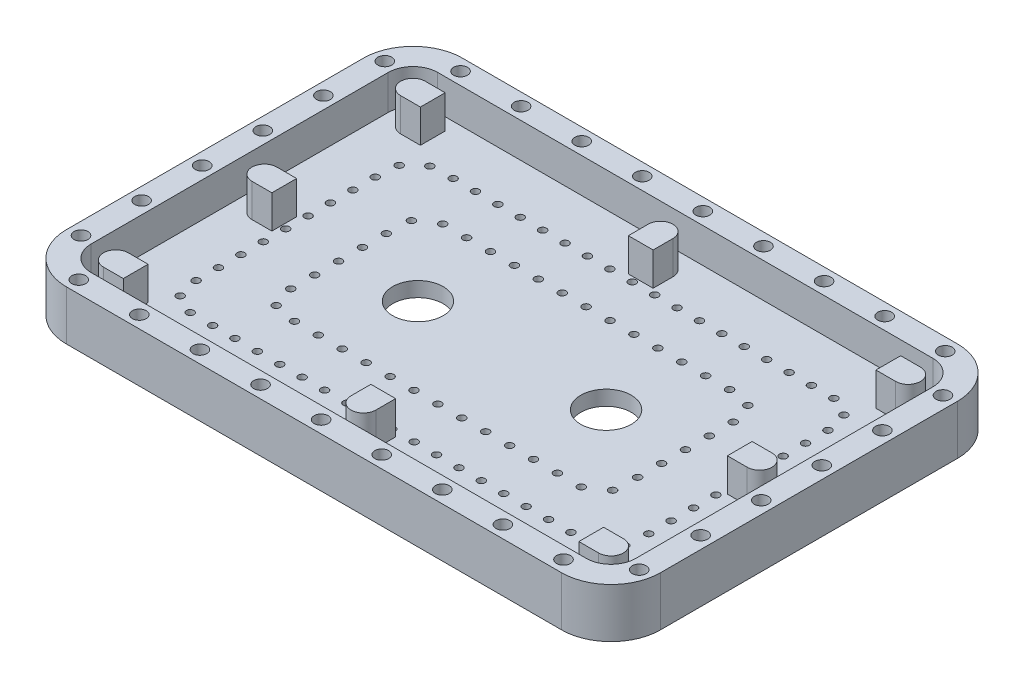
from build123d import *

# Parameters (mm, degrees)
SKETCH1_W                       = 120
SKETCH1_H                       = 80
BOSS_EXTRUDE1_DEPTH             = 10
SKETCH2_W                       = 110
SKETCH2_H                       = 70
CUT_EXTRUDE1_DEPTH              = 7
F_10_2_10_2_DIAMETER_HOLE1_D    = 10.2
FILLET1_R                       = 10
FILLET3_R                       = 5
F_2_5MM_CLEARANCE_DOWEL_HOLE1_D = 2.8
CRVPATTERN1_START               = -3
CRVPATTERN1_OUTLINE_R           = 1.4
CRVPATTERN1_DEPTH               = 10
F_1_5MM_DOWEL_HOLE2_D           = 1.5
CRVPATTERN3_START               = -3
CRVPATTERN3_OUTLINE_R           = 0.75
CRVPATTERN3_DEPTH               = 3
F_1_5MM_DOWEL_HOLE3_D           = 1.5
CRVPATTERN4_START               = -3
CRVPATTERN4_OUTLINE_R           = 0.75
CRVPATTERN4_DEPTH               = 3
BOSS_EXTRUDE2_DEPTH             = 6.7
SKETCH24_R                      = 2
CUT_EXTRUDE2_DEPTH              = 1.5
CRVPATTERN5_START               = -3
CRVPATTERN5_OUTLINE_R           = 2
CRVPATTERN5_OUTLINE_R_2         = 1.4
CRVPATTERN5_DEPTH               = 1.5


# Read off the part's stored shape, not the designer's step: CrvPattern1, CrvPattern3, CrvPattern4, CrvPattern5
with BuildPart() as part:
    # Sketch1 → Boss-Extrude1 (new body)
    with BuildSketch(Plane(origin=(0, 7, 0), x_dir=(1, 0, 0), z_dir=(0, 1, 0))):
        Rectangle(SKETCH1_W, SKETCH1_H)
    extrude(amount=-BOSS_EXTRUDE1_DEPTH)

    # Sketch2 → Cut-Extrude1 (cut)
    with BuildSketch(Plane(origin=(0, 7, 0), x_dir=(-1, 0, 0), z_dir=(0, 1, 0))):
        Rectangle(SKETCH2_W, SKETCH2_H)
    extrude(amount=-CUT_EXTRUDE1_DEPTH, mode=Mode.SUBTRACT)

    # Ø10.2 (10.2) Diameter Hole1 (through all)
    with Locations(Plane(origin=(0, 0, 0), x_dir=(1, 0, 0), z_dir=(0, 1, 0))):
        with Locations((19, 0), (-19, 0)):
            Hole(F_10_2_10_2_DIAMETER_HOLE1_D / 2)

    # Fillet1
    fillet1_edges = [part.edges().sort_by_distance(p)[0] for p in [
        (-60, 2, -40),
        (60, 2, -40),
        (60, 2, 40),
        (-60, 2, 40),
    ]]
    fillet(fillet1_edges, radius=FILLET1_R)

    # Fillet3
    fillet3_edges = [part.edges().sort_by_distance(p)[0] for p in [
        (-55, 3.5, 35),
        (-55, 3.5, -35),
        (55, 3.5, -35),
        (55, 3.5, 35),
    ]]
    fillet(fillet3_edges, radius=FILLET3_R)

    # Ø2.5mm Clearance Dowel Hole1 (through all)
    with Locations(Plane(origin=(0, 7, 0), x_dir=(1, 0, 0), z_dir=(0, 1, 0))):
        with Locations((50, 37.5)):
            Hole(F_2_5MM_CLEARANCE_DOWEL_HOLE1_D / 2)

    # CrvPattern1 outline → CrvPattern1 (cut)
    with BuildSketch(Plane(origin=(0, 0, 0), x_dir=(1, 0, 0), z_dir=(0, 1, 0)).offset(CRVPATTERN1_START)):
        with Locations((37.762537007, 37.5)):
            Circle(CRVPATTERN1_OUTLINE_R)
        with Locations((25.525074013, 37.5)):
            Circle(CRVPATTERN1_OUTLINE_R)
        with Locations((13.28761102, 37.5)):
            Circle(CRVPATTERN1_OUTLINE_R)
        with Locations((1.050148026, 37.5)):
            Circle(CRVPATTERN1_OUTLINE_R)
        with Locations((-11.187314967, 37.5)):
            Circle(CRVPATTERN1_OUTLINE_R)
        with Locations((-23.424777961, 37.5)):
            Circle(CRVPATTERN1_OUTLINE_R)
        with Locations((-35.662240954, 37.5)):
            Circle(CRVPATTERN1_OUTLINE_R)
        with Locations((-47.899703948, 37.5)):
            Circle(CRVPATTERN1_OUTLINE_R)
        with Locations((-57.320580195, 31.630676428)):
            Circle(CRVPATTERN1_OUTLINE_R)
        with Locations((-57.5, 19.406342516)):
            Circle(CRVPATTERN1_OUTLINE_R)
        with Locations((-57.5, 7.168879523)):
            Circle(CRVPATTERN1_OUTLINE_R)
        with Locations((-57.5, -5.068583471)):
            Circle(CRVPATTERN1_OUTLINE_R)
        with Locations((-57.5, -17.306046464)):
            Circle(CRVPATTERN1_OUTLINE_R)
        with Locations((-57.5, -29.543509458)):
            Circle(CRVPATTERN1_OUTLINE_R)
        with Locations((-50, -37.5)):
            Circle(CRVPATTERN1_OUTLINE_R)
        with Locations((-37.762537007, -37.5)):
            Circle(CRVPATTERN1_OUTLINE_R)
        with Locations((-25.525074013, -37.5)):
            Circle(CRVPATTERN1_OUTLINE_R)
        with Locations((-13.28761102, -37.5)):
            Circle(CRVPATTERN1_OUTLINE_R)
        with Locations((-1.050148026, -37.5)):
            Circle(CRVPATTERN1_OUTLINE_R)
        with Locations((11.187314967, -37.5)):
            Circle(CRVPATTERN1_OUTLINE_R)
        with Locations((23.424777961, -37.5)):
            Circle(CRVPATTERN1_OUTLINE_R)
        with Locations((35.662240954, -37.5)):
            Circle(CRVPATTERN1_OUTLINE_R)
        with Locations((47.899703948, -37.5)):
            Circle(CRVPATTERN1_OUTLINE_R)
        with Locations((57.320580195, -31.630676428)):
            Circle(CRVPATTERN1_OUTLINE_R)
        with Locations((57.5, -19.406342516)):
            Circle(CRVPATTERN1_OUTLINE_R)
        with Locations((57.5, -7.168879523)):
            Circle(CRVPATTERN1_OUTLINE_R)
        with Locations((57.5, 5.068583471)):
            Circle(CRVPATTERN1_OUTLINE_R)
        with Locations((57.5, 17.306046464)):
            Circle(CRVPATTERN1_OUTLINE_R)
        with Locations((57.5, 29.543509458)):
            Circle(CRVPATTERN1_OUTLINE_R)
    extrude(amount=CRVPATTERN1_DEPTH, mode=Mode.SUBTRACT)

    # Ø1.5mm Dowel Hole2 (through all)
    with Locations(Plane(origin=(0, 0, 0), x_dir=(1, 0, 0), z_dir=(0, 1, 0))):
        with Locations((40, 25)):
            Hole(F_1_5MM_DOWEL_HOLE2_D / 2)

    # CrvPattern3 outline → CrvPattern3 (cut)
    with BuildSketch(Plane(origin=(0, 0, 0), x_dir=(1, 0, 0), z_dir=(0, 1, 0)).offset(CRVPATTERN3_START)):
        with Locations((35.476401224, 25)):
            Circle(CRVPATTERN3_OUTLINE_R)
        with Locations((30.952802449, 25)):
            Circle(CRVPATTERN3_OUTLINE_R)
        with Locations((26.429203673, 25)):
            Circle(CRVPATTERN3_OUTLINE_R)
        with Locations((21.905604898, 25)):
            Circle(CRVPATTERN3_OUTLINE_R)
        with Locations((17.382006122, 25)):
            Circle(CRVPATTERN3_OUTLINE_R)
        with Locations((12.858407346, 25)):
            Circle(CRVPATTERN3_OUTLINE_R)
        with Locations((8.334808571, 25)):
            Circle(CRVPATTERN3_OUTLINE_R)
        with Locations((3.811209795, 25)):
            Circle(CRVPATTERN3_OUTLINE_R)
        with Locations((-0.71238898, 25)):
            Circle(CRVPATTERN3_OUTLINE_R)
        with Locations((-5.235987756, 25)):
            Circle(CRVPATTERN3_OUTLINE_R)
        with Locations((-9.759586532, 25)):
            Circle(CRVPATTERN3_OUTLINE_R)
        with Locations((-14.283185307, 25)):
            Circle(CRVPATTERN3_OUTLINE_R)
        with Locations((-18.806784083, 25)):
            Circle(CRVPATTERN3_OUTLINE_R)
        with Locations((-23.330382858, 25)):
            Circle(CRVPATTERN3_OUTLINE_R)
        with Locations((-27.853981634, 25)):
            Circle(CRVPATTERN3_OUTLINE_R)
        with Locations((-32.37758041, 25)):
            Circle(CRVPATTERN3_OUTLINE_R)
        with Locations((-36.901179185, 25)):
            Circle(CRVPATTERN3_OUTLINE_R)
        with Locations((-41.405574173, 24.798370687)):
            Circle(CRVPATTERN3_OUTLINE_R)
        with Locations((-44.64124129, 21.859806251)):
            Circle(CRVPATTERN3_OUTLINE_R)
        with Locations((-45, 17.382006122)):
            Circle(CRVPATTERN3_OUTLINE_R)
        with Locations((-45, 12.858407346)):
            Circle(CRVPATTERN3_OUTLINE_R)
        with Locations((-45, 8.334808571)):
            Circle(CRVPATTERN3_OUTLINE_R)
        with Locations((-45, 3.811209795)):
            Circle(CRVPATTERN3_OUTLINE_R)
        with Locations((-45, -0.71238898)):
            Circle(CRVPATTERN3_OUTLINE_R)
        with Locations((-45, -5.235987756)):
            Circle(CRVPATTERN3_OUTLINE_R)
        with Locations((-45, -9.759586532)):
            Circle(CRVPATTERN3_OUTLINE_R)
        with Locations((-45, -14.283185307)):
            Circle(CRVPATTERN3_OUTLINE_R)
        with Locations((-45, -18.806784083)):
            Circle(CRVPATTERN3_OUTLINE_R)
        with Locations((-43.931260104, -23.089529736)):
            Circle(CRVPATTERN3_OUTLINE_R)
        with Locations((-40, -25)):
            Circle(CRVPATTERN3_OUTLINE_R)
        with Locations((-35.476401224, -25)):
            Circle(CRVPATTERN3_OUTLINE_R)
        with Locations((-30.952802449, -25)):
            Circle(CRVPATTERN3_OUTLINE_R)
        with Locations((-26.429203673, -25)):
            Circle(CRVPATTERN3_OUTLINE_R)
        with Locations((-21.905604898, -25)):
            Circle(CRVPATTERN3_OUTLINE_R)
        with Locations((-17.382006122, -25)):
            Circle(CRVPATTERN3_OUTLINE_R)
        with Locations((-12.858407346, -25)):
            Circle(CRVPATTERN3_OUTLINE_R)
        with Locations((-8.334808571, -25)):
            Circle(CRVPATTERN3_OUTLINE_R)
        with Locations((-3.811209795, -25)):
            Circle(CRVPATTERN3_OUTLINE_R)
        with Locations((0.71238898, -25)):
            Circle(CRVPATTERN3_OUTLINE_R)
        with Locations((5.235987756, -25)):
            Circle(CRVPATTERN3_OUTLINE_R)
        with Locations((9.759586532, -25)):
            Circle(CRVPATTERN3_OUTLINE_R)
        with Locations((14.283185307, -25)):
            Circle(CRVPATTERN3_OUTLINE_R)
        with Locations((18.806784083, -25)):
            Circle(CRVPATTERN3_OUTLINE_R)
        with Locations((23.330382858, -25)):
            Circle(CRVPATTERN3_OUTLINE_R)
        with Locations((27.853981634, -25)):
            Circle(CRVPATTERN3_OUTLINE_R)
        with Locations((32.37758041, -25)):
            Circle(CRVPATTERN3_OUTLINE_R)
        with Locations((36.901179185, -25)):
            Circle(CRVPATTERN3_OUTLINE_R)
        with Locations((41.405574173, -24.798370687)):
            Circle(CRVPATTERN3_OUTLINE_R)
        with Locations((44.64124129, -21.859806251)):
            Circle(CRVPATTERN3_OUTLINE_R)
        with Locations((45, -17.382006122)):
            Circle(CRVPATTERN3_OUTLINE_R)
        with Locations((45, -12.858407346)):
            Circle(CRVPATTERN3_OUTLINE_R)
        with Locations((45, -8.334808571)):
            Circle(CRVPATTERN3_OUTLINE_R)
        with Locations((45, -3.811209795)):
            Circle(CRVPATTERN3_OUTLINE_R)
        with Locations((45, 0.71238898)):
            Circle(CRVPATTERN3_OUTLINE_R)
        with Locations((45, 5.235987756)):
            Circle(CRVPATTERN3_OUTLINE_R)
        with Locations((45, 9.759586532)):
            Circle(CRVPATTERN3_OUTLINE_R)
        with Locations((45, 14.283185307)):
            Circle(CRVPATTERN3_OUTLINE_R)
        with Locations((45, 18.806784083)):
            Circle(CRVPATTERN3_OUTLINE_R)
        with Locations((43.931260104, 23.089529736)):
            Circle(CRVPATTERN3_OUTLINE_R)
    extrude(amount=CRVPATTERN3_DEPTH, mode=Mode.SUBTRACT)

    # Ø1.5mm Dowel Hole3 (through all)
    with Locations(Plane(origin=(0, -3, 0), x_dir=(-1, 0, 0), z_dir=(0, -1, 0))):
        with Locations((-30, -16)):
            Hole(F_1_5MM_DOWEL_HOLE3_D / 2)

    # CrvPattern4 outline → CrvPattern4 (cut)
    with BuildSketch(Plane(origin=(0, 0, 0), x_dir=(1, 0, 0), z_dir=(0, 1, 0)).offset(CRVPATTERN4_START)):
        with Locations((25.171681469, -16)):
            Circle(CRVPATTERN4_OUTLINE_R)
        with Locations((20.343362939, -16)):
            Circle(CRVPATTERN4_OUTLINE_R)
        with Locations((15.515044408, -16)):
            Circle(CRVPATTERN4_OUTLINE_R)
        with Locations((10.686725877, -16)):
            Circle(CRVPATTERN4_OUTLINE_R)
        with Locations((5.858407346, -16)):
            Circle(CRVPATTERN4_OUTLINE_R)
        with Locations((1.030088816, -16)):
            Circle(CRVPATTERN4_OUTLINE_R)
        with Locations((-3.798229715, -16)):
            Circle(CRVPATTERN4_OUTLINE_R)
        with Locations((-8.626548246, -16)):
            Circle(CRVPATTERN4_OUTLINE_R)
        with Locations((-13.454866776, -16)):
            Circle(CRVPATTERN4_OUTLINE_R)
        with Locations((-18.283185307, -16)):
            Circle(CRVPATTERN4_OUTLINE_R)
        with Locations((-23.111503838, -16)):
            Circle(CRVPATTERN4_OUTLINE_R)
        with Locations((-27.939822369, -16)):
            Circle(CRVPATTERN4_OUTLINE_R)
        with Locations((-32.552422087, -15.079795689)):
            Circle(CRVPATTERN4_OUTLINE_R)
        with Locations((-34, -10.686725877)):
            Circle(CRVPATTERN4_OUTLINE_R)
        with Locations((-34, -5.858407346)):
            Circle(CRVPATTERN4_OUTLINE_R)
        with Locations((-34, -1.030088816)):
            Circle(CRVPATTERN4_OUTLINE_R)
        with Locations((-34, 3.798229715)):
            Circle(CRVPATTERN4_OUTLINE_R)
        with Locations((-34, 8.626548246)):
            Circle(CRVPATTERN4_OUTLINE_R)
        with Locations((-33.738324268, 13.423000937)):
            Circle(CRVPATTERN4_OUTLINE_R)
        with Locations((-30, 16)):
            Circle(CRVPATTERN4_OUTLINE_R)
        with Locations((-25.171681469, 16)):
            Circle(CRVPATTERN4_OUTLINE_R)
        with Locations((-20.343362939, 16)):
            Circle(CRVPATTERN4_OUTLINE_R)
        with Locations((-15.515044408, 16)):
            Circle(CRVPATTERN4_OUTLINE_R)
        with Locations((-10.686725877, 16)):
            Circle(CRVPATTERN4_OUTLINE_R)
        with Locations((-5.858407346, 16)):
            Circle(CRVPATTERN4_OUTLINE_R)
        with Locations((-1.030088816, 16)):
            Circle(CRVPATTERN4_OUTLINE_R)
        with Locations((3.798229715, 16)):
            Circle(CRVPATTERN4_OUTLINE_R)
        with Locations((8.626548246, 16)):
            Circle(CRVPATTERN4_OUTLINE_R)
        with Locations((13.454866776, 16)):
            Circle(CRVPATTERN4_OUTLINE_R)
        with Locations((18.283185307, 16)):
            Circle(CRVPATTERN4_OUTLINE_R)
        with Locations((23.111503838, 16)):
            Circle(CRVPATTERN4_OUTLINE_R)
        with Locations((27.939822369, 16)):
            Circle(CRVPATTERN4_OUTLINE_R)
        with Locations((32.552422087, 15.079795689)):
            Circle(CRVPATTERN4_OUTLINE_R)
        with Locations((34, 10.686725877)):
            Circle(CRVPATTERN4_OUTLINE_R)
        with Locations((34, 5.858407346)):
            Circle(CRVPATTERN4_OUTLINE_R)
        with Locations((34, 1.030088816)):
            Circle(CRVPATTERN4_OUTLINE_R)
        with Locations((34, -3.798229715)):
            Circle(CRVPATTERN4_OUTLINE_R)
        with Locations((34, -8.626548246)):
            Circle(CRVPATTERN4_OUTLINE_R)
        with Locations((33.738324268, -13.423000937)):
            Circle(CRVPATTERN4_OUTLINE_R)
    extrude(amount=CRVPATTERN4_DEPTH, mode=Mode.SUBTRACT)

    # Sketch23 → Boss-Extrude2 (add)
    with BuildSketch(Plane(origin=(0, 0, 0), x_dir=(1, 0, 0), z_dir=(0, 1, 0))):
        with BuildLine():
            ThreePointArc((52.5, -30), (51.767766953, -28.232233047), (50, -27.5))
            Line((50, -27.5), (50, -32.5))
            ThreePointArc((50, -32.5), (51.767766953, -31.767766953), (52.5, -30))
        make_face()
        with BuildLine():
            Line((50, -32.5), (50, -27.5))
            ThreePointArc((50, -27.5), (47.5, -30), (50, -32.5))
        make_face()
        with BuildLine():
            ThreePointArc((50, -32.5), (47.5, -30), (50, -27.5))
            Line((50, -27.5), (46, -27.5))
            Line((46, -27.5), (46, -32.5))
            Line((46, -32.5), (50, -32.5))
        make_face()
        with BuildLine():
            Line((46, -2.5), (50, -2.5))
            ThreePointArc((50, -2.5), (47.5, 0), (50, 2.5))
            Line((50, 2.5), (46, 2.5))
            Line((46, 2.5), (46, -2.5))
        make_face()
        with BuildLine():
            ThreePointArc((50, 2.5), (47.5, 0), (50, -2.5))
            Line((50, -2.5), (50, 2.5))
        make_face()
        with BuildLine():
            Line((50, 2.5), (50, -2.5))
            ThreePointArc((50, -2.5), (51.767766953, -1.767766953), (52.5, 0))
            ThreePointArc((52.5, 0), (51.767766953, 1.767766953), (50, 2.5))
        make_face()
        with BuildLine():
            Line((46, 27.5), (50, 27.5))
            ThreePointArc((50, 27.5), (47.5, 30), (50, 32.5))
            Line((50, 32.5), (46, 32.5))
            Line((46, 32.5), (46, 27.5))
        make_face()
        with BuildLine():
            ThreePointArc((50, 32.5), (47.5, 30), (50, 27.5))
            Line((50, 27.5), (50, 32.5))
        make_face()
        with BuildLine():
            Line((50, 32.5), (50, 27.5))
            ThreePointArc((50, 27.5), (51.767766953, 28.232233047), (52.5, 30))
            ThreePointArc((52.5, 30), (51.767766953, 31.767766953), (50, 32.5))
        make_face()
        with BuildLine():
            ThreePointArc((2.5, 30), (0, 27.5), (-2.5, 30))
            Line((-2.5, 30), (-2.5, 26))
            Line((-2.5, 26), (2.5, 26))
            Line((2.5, 26), (2.5, 30))
        make_face()
        with BuildLine():
            ThreePointArc((2.5, 30), (0, 32.5), (-2.5, 30))
            Line((-2.5, 30), (2.5, 30))
        make_face()
        with BuildLine():
            Line((2.5, 30), (-2.5, 30))
            ThreePointArc((-2.5, 30), (0, 27.5), (2.5, 30))
        make_face()
        with BuildLine():
            ThreePointArc((-2.5, -30), (0, -27.5), (2.5, -30))
            Line((2.5, -30), (2.5, -26))
            Line((2.5, -26), (-2.5, -26))
            Line((-2.5, -26), (-2.5, -30))
        make_face()
        with BuildLine():
            ThreePointArc((-2.5, -30), (0, -32.5), (2.5, -30))
            Line((2.5, -30), (-2.5, -30))
        make_face()
        with BuildLine():
            Line((-2.5, -30), (2.5, -30))
            ThreePointArc((2.5, -30), (0, -27.5), (-2.5, -30))
        make_face()
        with BuildLine():
            ThreePointArc((-50, -27.5), (-52.5, -30), (-50, -32.5))
            Line((-50, -32.5), (-50, -27.5))
        make_face()
        with BuildLine():
            Line((-50, -27.5), (-50, -32.5))
            ThreePointArc((-50, -32.5), (-48.232233047, -31.767766953), (-47.5, -30))
            ThreePointArc((-47.5, -30), (-48.232233047, -28.232233047), (-50, -27.5))
        make_face()
        with BuildLine():
            ThreePointArc((-47.5, -30), (-48.232233047, -31.767766953), (-50, -32.5))
            Line((-50, -32.5), (-46, -32.5))
            Line((-46, -32.5), (-46, -27.5))
            Line((-46, -27.5), (-50, -27.5))
            ThreePointArc((-50, -27.5), (-48.232233047, -28.232233047), (-47.5, -30))
        make_face()
        with BuildLine():
            ThreePointArc((-50, 32.5), (-52.5, 30), (-50, 27.5))
            Line((-50, 27.5), (-50, 32.5))
        make_face()
        with BuildLine():
            Line((-50, 32.5), (-50, 27.5))
            ThreePointArc((-50, 27.5), (-48.232233047, 28.232233047), (-47.5, 30))
            ThreePointArc((-47.5, 30), (-48.232233047, 31.767766953), (-50, 32.5))
        make_face()
        with BuildLine():
            ThreePointArc((-47.5, 30), (-48.232233047, 28.232233047), (-50, 27.5))
            Line((-50, 27.5), (-46, 27.5))
            Line((-46, 27.5), (-46, 32.5))
            Line((-46, 32.5), (-50, 32.5))
            ThreePointArc((-50, 32.5), (-48.232233047, 31.767766953), (-47.5, 30))
        make_face()
        with BuildLine():
            ThreePointArc((-50, 2.5), (-52.5, 0), (-50, -2.5))
            Line((-50, -2.5), (-50, 2.5))
        make_face()
        with BuildLine():
            Line((-50, 2.5), (-50, -2.5))
            ThreePointArc((-50, -2.5), (-48.232233047, -1.767766953), (-47.5, 0))
            ThreePointArc((-47.5, 0), (-48.232233047, 1.767766953), (-50, 2.5))
        make_face()
        with BuildLine():
            ThreePointArc((-47.5, 0), (-48.232233047, -1.767766953), (-50, -2.5))
            Line((-50, -2.5), (-46, -2.5))
            Line((-46, -2.5), (-46, 2.5))
            Line((-46, 2.5), (-50, 2.5))
            ThreePointArc((-50, 2.5), (-48.232233047, 1.767766953), (-47.5, 0))
        make_face()
    extrude(amount=BOSS_EXTRUDE2_DEPTH)

    # Sketch24 → Cut-Extrude2 (cut)
    with BuildSketch(Plane.XZ.offset(3)):
        with Locations(Location((57.5, 19.406342516, 0), (0, 0, 270))):
            Circle(SKETCH24_R)
    extrude(amount=-CUT_EXTRUDE2_DEPTH, mode=Mode.SUBTRACT)

    # CrvPattern5 outline → CrvPattern5 (cut)
    # profile 1 of 29: a face of its own
    with BuildSketch(Plane(origin=(0, 0, 0), x_dir=(1, 0, 0), z_dir=(0, 1, 0)).offset(CRVPATTERN5_START)):
        with Locations((57.5, 29.543509458)):
            Circle(CRVPATTERN5_OUTLINE_R)
        with Locations((57.5, 29.543509458)):
            Circle(CRVPATTERN5_OUTLINE_R_2, mode=Mode.SUBTRACT)
    # profile 2 of 29: a face of its own
    with BuildSketch(Plane(origin=(0, 0, 0), x_dir=(1, 0, 0), z_dir=(0, 1, 0)).offset(CRVPATTERN5_START)):
        with Locations((57.5, 17.306046464)):
            Circle(CRVPATTERN5_OUTLINE_R)
        with Locations((57.5, 17.306046464)):
            Circle(CRVPATTERN5_OUTLINE_R_2, mode=Mode.SUBTRACT)
    # profile 3 of 29: a face of its own
    with BuildSketch(Plane(origin=(0, 0, 0), x_dir=(1, 0, 0), z_dir=(0, 1, 0)).offset(CRVPATTERN5_START)):
        with Locations((57.5, 5.068583471)):
            Circle(CRVPATTERN5_OUTLINE_R)
        with Locations((57.5, 5.068583471)):
            Circle(CRVPATTERN5_OUTLINE_R_2, mode=Mode.SUBTRACT)
    # profile 4 of 29: a face of its own
    with BuildSketch(Plane(origin=(0, 0, 0), x_dir=(1, 0, 0), z_dir=(0, 1, 0)).offset(CRVPATTERN5_START)):
        with Locations((57.5, -7.168879523)):
            Circle(CRVPATTERN5_OUTLINE_R)
        with Locations((57.5, -7.168879523)):
            Circle(CRVPATTERN5_OUTLINE_R_2, mode=Mode.SUBTRACT)
    # profile 5 of 29: a face of its own
    with BuildSketch(Plane(origin=(0, 0, 0), x_dir=(1, 0, 0), z_dir=(0, 1, 0)).offset(CRVPATTERN5_START)):
        with Locations((57.320580195, -31.630676428)):
            Circle(CRVPATTERN5_OUTLINE_R)
        with Locations((57.320580195, -31.630676428)):
            Circle(CRVPATTERN5_OUTLINE_R_2, mode=Mode.SUBTRACT)
    # profile 6 of 29: a face of its own
    with BuildSketch(Plane(origin=(0, 0, 0), x_dir=(1, 0, 0), z_dir=(0, 1, 0)).offset(CRVPATTERN5_START)):
        with Locations((47.899703948, -37.5)):
            Circle(CRVPATTERN5_OUTLINE_R)
        with Locations((47.899703948, -37.5)):
            Circle(CRVPATTERN5_OUTLINE_R_2, mode=Mode.SUBTRACT)
    # profile 7 of 29: a face of its own
    with BuildSketch(Plane(origin=(0, 0, 0), x_dir=(1, 0, 0), z_dir=(0, 1, 0)).offset(CRVPATTERN5_START)):
        with Locations((35.662240954, -37.5)):
            Circle(CRVPATTERN5_OUTLINE_R)
        with Locations((35.662240954, -37.5)):
            Circle(CRVPATTERN5_OUTLINE_R_2, mode=Mode.SUBTRACT)
    # profile 8 of 29: a face of its own
    with BuildSketch(Plane(origin=(0, 0, 0), x_dir=(1, 0, 0), z_dir=(0, 1, 0)).offset(CRVPATTERN5_START)):
        with Locations((23.424777961, -37.5)):
            Circle(CRVPATTERN5_OUTLINE_R)
        with Locations((23.424777961, -37.5)):
            Circle(CRVPATTERN5_OUTLINE_R_2, mode=Mode.SUBTRACT)
    # profile 9 of 29: a face of its own
    with BuildSketch(Plane(origin=(0, 0, 0), x_dir=(1, 0, 0), z_dir=(0, 1, 0)).offset(CRVPATTERN5_START)):
        with Locations((11.187314967, -37.5)):
            Circle(CRVPATTERN5_OUTLINE_R)
        with Locations((11.187314967, -37.5)):
            Circle(CRVPATTERN5_OUTLINE_R_2, mode=Mode.SUBTRACT)
    # profile 10 of 29: a face of its own
    with BuildSketch(Plane(origin=(0, 0, 0), x_dir=(1, 0, 0), z_dir=(0, 1, 0)).offset(CRVPATTERN5_START)):
        with Locations((-1.050148026, -37.5)):
            Circle(CRVPATTERN5_OUTLINE_R)
        with Locations((-1.050148026, -37.5)):
            Circle(CRVPATTERN5_OUTLINE_R_2, mode=Mode.SUBTRACT)
    # profile 11 of 29: a face of its own
    with BuildSketch(Plane(origin=(0, 0, 0), x_dir=(1, 0, 0), z_dir=(0, 1, 0)).offset(CRVPATTERN5_START)):
        with Locations((-13.28761102, -37.5)):
            Circle(CRVPATTERN5_OUTLINE_R)
        with Locations((-13.28761102, -37.5)):
            Circle(CRVPATTERN5_OUTLINE_R_2, mode=Mode.SUBTRACT)
    # profile 12 of 29: a face of its own
    with BuildSketch(Plane(origin=(0, 0, 0), x_dir=(1, 0, 0), z_dir=(0, 1, 0)).offset(CRVPATTERN5_START)):
        with Locations((-25.525074013, -37.5)):
            Circle(CRVPATTERN5_OUTLINE_R)
        with Locations((-25.525074013, -37.5)):
            Circle(CRVPATTERN5_OUTLINE_R_2, mode=Mode.SUBTRACT)
    # profile 13 of 29: a face of its own
    with BuildSketch(Plane(origin=(0, 0, 0), x_dir=(1, 0, 0), z_dir=(0, 1, 0)).offset(CRVPATTERN5_START)):
        with Locations((-37.762537007, -37.5)):
            Circle(CRVPATTERN5_OUTLINE_R)
        with Locations((-37.762537007, -37.5)):
            Circle(CRVPATTERN5_OUTLINE_R_2, mode=Mode.SUBTRACT)
    # profile 14 of 29: a face of its own
    with BuildSketch(Plane(origin=(0, 0, 0), x_dir=(1, 0, 0), z_dir=(0, 1, 0)).offset(CRVPATTERN5_START)):
        with Locations((-50, -37.5)):
            Circle(CRVPATTERN5_OUTLINE_R)
        with Locations((-50, -37.5)):
            Circle(CRVPATTERN5_OUTLINE_R_2, mode=Mode.SUBTRACT)
    # profile 15 of 29: a face of its own
    with BuildSketch(Plane(origin=(0, 0, 0), x_dir=(1, 0, 0), z_dir=(0, 1, 0)).offset(CRVPATTERN5_START)):
        with Locations((-57.5, -29.543509458)):
            Circle(CRVPATTERN5_OUTLINE_R)
        with Locations((-57.5, -29.543509458)):
            Circle(CRVPATTERN5_OUTLINE_R_2, mode=Mode.SUBTRACT)
    # profile 16 of 29: a face of its own
    with BuildSketch(Plane(origin=(0, 0, 0), x_dir=(1, 0, 0), z_dir=(0, 1, 0)).offset(CRVPATTERN5_START)):
        with Locations((-57.5, -17.306046464)):
            Circle(CRVPATTERN5_OUTLINE_R)
        with Locations((-57.5, -17.306046464)):
            Circle(CRVPATTERN5_OUTLINE_R_2, mode=Mode.SUBTRACT)
    # profile 17 of 29: a face of its own
    with BuildSketch(Plane(origin=(0, 0, 0), x_dir=(1, 0, 0), z_dir=(0, 1, 0)).offset(CRVPATTERN5_START)):
        with Locations((-57.5, -5.068583471)):
            Circle(CRVPATTERN5_OUTLINE_R)
        with Locations((-57.5, -5.068583471)):
            Circle(CRVPATTERN5_OUTLINE_R_2, mode=Mode.SUBTRACT)
    # profile 18 of 29: a face of its own
    with BuildSketch(Plane(origin=(0, 0, 0), x_dir=(1, 0, 0), z_dir=(0, 1, 0)).offset(CRVPATTERN5_START)):
        with Locations((-57.5, 7.168879523)):
            Circle(CRVPATTERN5_OUTLINE_R)
        with Locations((-57.5, 7.168879523)):
            Circle(CRVPATTERN5_OUTLINE_R_2, mode=Mode.SUBTRACT)
    # profile 19 of 29: a face of its own
    with BuildSketch(Plane(origin=(0, 0, 0), x_dir=(1, 0, 0), z_dir=(0, 1, 0)).offset(CRVPATTERN5_START)):
        with Locations((-57.5, 19.406342516)):
            Circle(CRVPATTERN5_OUTLINE_R)
        with Locations((-57.5, 19.406342516)):
            Circle(CRVPATTERN5_OUTLINE_R_2, mode=Mode.SUBTRACT)
    # profile 20 of 29: a face of its own
    with BuildSketch(Plane(origin=(0, 0, 0), x_dir=(1, 0, 0), z_dir=(0, 1, 0)).offset(CRVPATTERN5_START)):
        with Locations((-57.320580195, 31.630676428)):
            Circle(CRVPATTERN5_OUTLINE_R)
        with Locations((-57.320580195, 31.630676428)):
            Circle(CRVPATTERN5_OUTLINE_R_2, mode=Mode.SUBTRACT)
    # profile 21 of 29: a face of its own
    with BuildSketch(Plane(origin=(0, 0, 0), x_dir=(1, 0, 0), z_dir=(0, 1, 0)).offset(CRVPATTERN5_START)):
        with Locations((-47.899703948, 37.5)):
            Circle(CRVPATTERN5_OUTLINE_R)
        with Locations((-47.899703948, 37.5)):
            Circle(CRVPATTERN5_OUTLINE_R_2, mode=Mode.SUBTRACT)
    # profile 22 of 29: a face of its own
    with BuildSketch(Plane(origin=(0, 0, 0), x_dir=(1, 0, 0), z_dir=(0, 1, 0)).offset(CRVPATTERN5_START)):
        with Locations((-35.662240954, 37.5)):
            Circle(CRVPATTERN5_OUTLINE_R)
        with Locations((-35.662240954, 37.5)):
            Circle(CRVPATTERN5_OUTLINE_R_2, mode=Mode.SUBTRACT)
    # profile 23 of 29: a face of its own
    with BuildSketch(Plane(origin=(0, 0, 0), x_dir=(1, 0, 0), z_dir=(0, 1, 0)).offset(CRVPATTERN5_START)):
        with Locations((-23.424777961, 37.5)):
            Circle(CRVPATTERN5_OUTLINE_R)
        with Locations((-23.424777961, 37.5)):
            Circle(CRVPATTERN5_OUTLINE_R_2, mode=Mode.SUBTRACT)
    # profile 24 of 29: a face of its own
    with BuildSketch(Plane(origin=(0, 0, 0), x_dir=(1, 0, 0), z_dir=(0, 1, 0)).offset(CRVPATTERN5_START)):
        with Locations((-11.187314967, 37.5)):
            Circle(CRVPATTERN5_OUTLINE_R)
        with Locations((-11.187314967, 37.5)):
            Circle(CRVPATTERN5_OUTLINE_R_2, mode=Mode.SUBTRACT)
    # profile 25 of 29: a face of its own
    with BuildSketch(Plane(origin=(0, 0, 0), x_dir=(1, 0, 0), z_dir=(0, 1, 0)).offset(CRVPATTERN5_START)):
        with Locations((1.050148026, 37.5)):
            Circle(CRVPATTERN5_OUTLINE_R)
        with Locations((1.050148026, 37.5)):
            Circle(CRVPATTERN5_OUTLINE_R_2, mode=Mode.SUBTRACT)
    # profile 26 of 29: a face of its own
    with BuildSketch(Plane(origin=(0, 0, 0), x_dir=(1, 0, 0), z_dir=(0, 1, 0)).offset(CRVPATTERN5_START)):
        with Locations((13.28761102, 37.5)):
            Circle(CRVPATTERN5_OUTLINE_R)
        with Locations((13.28761102, 37.5)):
            Circle(CRVPATTERN5_OUTLINE_R_2, mode=Mode.SUBTRACT)
    # profile 27 of 29: a face of its own
    with BuildSketch(Plane(origin=(0, 0, 0), x_dir=(1, 0, 0), z_dir=(0, 1, 0)).offset(CRVPATTERN5_START)):
        with Locations((25.525074013, 37.5)):
            Circle(CRVPATTERN5_OUTLINE_R)
        with Locations((25.525074013, 37.5)):
            Circle(CRVPATTERN5_OUTLINE_R_2, mode=Mode.SUBTRACT)
    # profile 28 of 29: a face of its own
    with BuildSketch(Plane(origin=(0, 0, 0), x_dir=(1, 0, 0), z_dir=(0, 1, 0)).offset(CRVPATTERN5_START)):
        with Locations((37.762537007, 37.5)):
            Circle(CRVPATTERN5_OUTLINE_R)
        with Locations((37.762537007, 37.5)):
            Circle(CRVPATTERN5_OUTLINE_R_2, mode=Mode.SUBTRACT)
    # profile 29 of 29: a face of its own
    with BuildSketch(Plane(origin=(0, 0, 0), x_dir=(1, 0, 0), z_dir=(0, 1, 0)).offset(CRVPATTERN5_START)):
        with Locations((50, 37.5)):
            Circle(CRVPATTERN5_OUTLINE_R)
        with Locations((50, 37.5)):
            Circle(CRVPATTERN5_OUTLINE_R_2, mode=Mode.SUBTRACT)
    extrude(amount=CRVPATTERN5_DEPTH, mode=Mode.SUBTRACT)


solid = part.part
